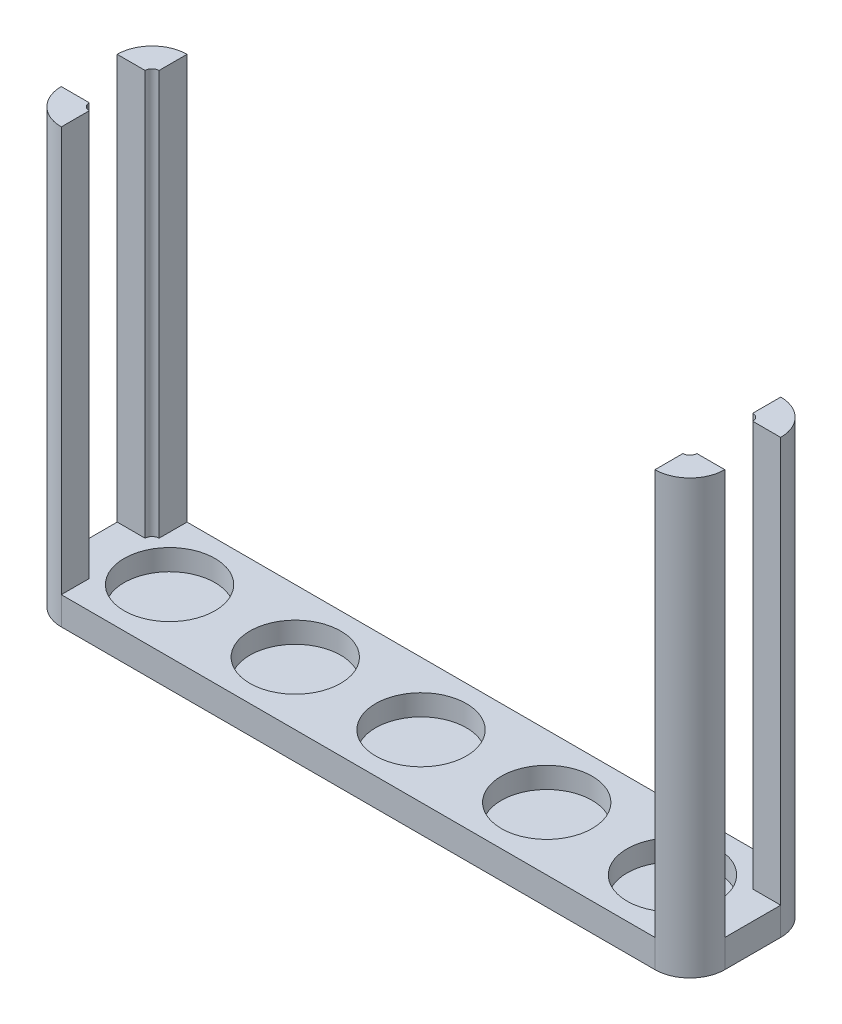
from build123d import *

# Parameters (mm, degrees)
SKETCH5_W           = 190
SKETCH5_H           = 36
BOSS_EXTRUDE1_DEPTH = 8
SKETCH6_R           = 13
SKETCH6_R_2         = 12.99768992
CUT_EXTRUDE1_DEPTH  = 6
BOSS_EXTRUDE2_DEPTH = 116
FILLET1_R           = 10


with BuildPart() as part:
    # Sketch5 → Boss-Extrude1 (new body)
    with BuildSketch(Plane(origin=(0, 0, 0), x_dir=(1, 0, 0), z_dir=(0, 1, 0))):
        with Locations((95, 18)):
            Rectangle(SKETCH5_W, SKETCH5_H)
    extrude(amount=BOSS_EXTRUDE1_DEPTH)

    # Sketch6 → Cut-Extrude1 (cut)
    with BuildSketch(Plane(origin=(0, 8, 0), x_dir=(1, 0, 0), z_dir=(0, 1, 0))):
        with Locations(Location((23, 18, 0), (0, 0, 270))):
            Circle(SKETCH6_R)
        with Locations(Location((59, 18, 0), (0, 0, 270))):
            Circle(SKETCH6_R)
        with Locations(Location((95.004620161, 18, 0), (0, 0, 270))):
            Circle(SKETCH6_R)
        with Locations(Location((131.004620161, 18, 0), (0, 0, 270))):
            Circle(SKETCH6_R)
        with Locations(Location((167.00231008, 18, 0), (0, 0, 270))):
            Circle(SKETCH6_R_2)
    extrude(amount=-CUT_EXTRUDE1_DEPTH, mode=Mode.SUBTRACT)

    # Sketch7 → Boss-Extrude2 (add)
    with BuildSketch(Plane(origin=(0, 8, 0), x_dir=(1, 0, 0), z_dir=(0, 1, 0))):
        with BuildLine():
            Line((0, 0), (10, 0))
            Line((10, 0), (10, 8))
            ThreePointArc((10, 8), (8.585786438, 8.585786438), (8, 10))
            Line((8, 10), (0, 10))
            Line((0, 10), (0, 0))
        make_face()
        with BuildLine():
            Line((0, 36), (10, 36))
            Line((10, 36), (10, 28))
            ThreePointArc((10, 28), (8.585786438, 27.414213562), (8, 26))
            Line((8, 26), (0, 26))
            Line((0, 26), (0, 36))
        make_face()
        with BuildLine():
            Line((190, 36), (180, 36))
            Line((180, 36), (180, 28))
            ThreePointArc((180, 28), (181.414213562, 27.414213562), (182, 26))
            Line((182, 26), (190, 26))
            Line((190, 26), (190, 36))
        make_face()
        with BuildLine():
            Line((190, 0), (180, 0))
            Line((180, 0), (180, 8))
            ThreePointArc((180, 8), (181.414213562, 8.585786438), (182, 10))
            Line((182, 10), (190, 10))
            Line((190, 10), (190, 0))
        make_face()
    extrude(amount=BOSS_EXTRUDE2_DEPTH)

    # Fillet1
    fillet1_edges = [part.edges().sort_by_distance(p)[0] for p in [
        (190, 62, 0),
        (190, 62, -36),
        (0, 62, -36),
        (0, 62, 0),
    ]]
    fillet(fillet1_edges, radius=FILLET1_R - 0.0001)  # a hair under: the kernel refuses the full size


solid = part.part
